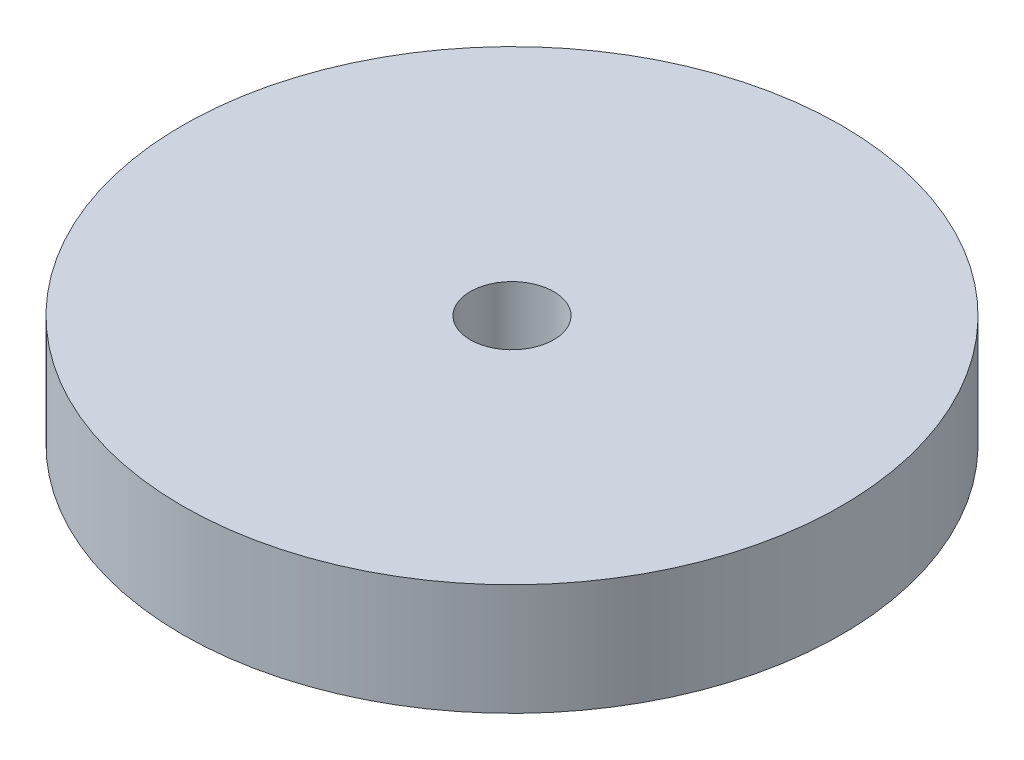
from build123d import *

# Parameters (mm, degrees)
SKETCH1_R           = 35.5
BOSS_EXTRUDE1_DEPTH = 12
SKETCH2_R           = 4.5
CUT_EXTRUDE1_DEPTH  = 52.618795027


with BuildPart() as part:
    # Sketch1 → Boss-Extrude1 (new body)
    with BuildSketch(Plane(origin=(0, 0, 0), x_dir=(1, 0, 0), z_dir=(0, 1, 0))):
        Circle(SKETCH1_R)
    extrude(amount=BOSS_EXTRUDE1_DEPTH)

    # Sketch2 → Cut-Extrude1 (cut, through all)
    with BuildSketch(Plane(origin=(0, 12, 0), x_dir=(1, 0, 0), z_dir=(0, 1, 0))):
        Circle(SKETCH2_R)
    extrude(amount=-CUT_EXTRUDE1_DEPTH, mode=Mode.SUBTRACT)


solid = part.part
